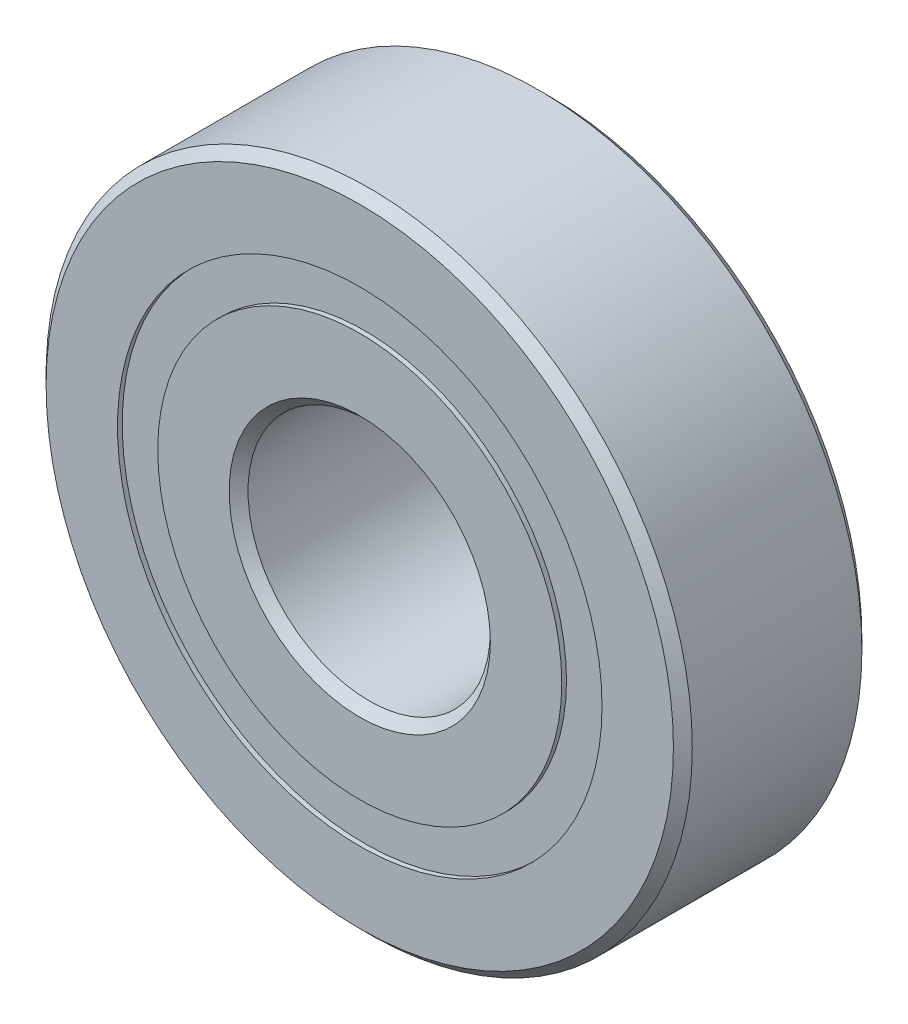
from build123d import *

# Parameters (mm, degrees)
CIRPATTERN1_COUNT = 10
SKETCH5_W         = 1.59927124
SKETCH5_H         = 1.494505494


with BuildPart() as part:
    # Sketch1 → Revolve1 (revolve)
    with BuildSketch(Plane(origin=(0, 0, 0), x_dir=(0, 0, -1), z_dir=(1, 0, 0))):
        with BuildLine():
            Line((3.15, 12), (-3.15, 12))
            Line((-3.15, 12), (-3.5, 11.65))
            Line((-3.5, 11.65), (-3.5, 8.997252747))
            Line((-3.5, 8.997252747), (-1.555555556, 8.997252747))
            ThreePointArc((-1.555555556, 8.997252747), (0, 9.97572876), (1.555555556, 8.997252747))
            Line((1.555555556, 8.997252747), (3.5, 8.997252747))
            Line((3.5, 8.997252747), (3.5, 11.65))
            Line((3.5, 11.65), (3.15, 12))
        make_face()
    revolve(axis=Axis((0, 0, 3.5), (0, 0, -1)))


with BuildPart() as body_2:
    # Sketch3 → Revolve3 (revolve)
    with BuildSketch(Plane(origin=(0, 0, 0), x_dir=(0, 0, -1), z_dir=(1, 0, 0))):
        with BuildLine():
            Line((-3.5, 7.502747253), (-1.555555556, 7.502747253))
            ThreePointArc((-1.555555556, 7.502747253), (0, 6.52427124), (1.555555556, 7.502747253))
            Line((1.555555556, 7.502747253), (3.5, 7.502747253))
            Line((3.5, 7.502747253), (3.5, 4.85))
            Line((3.5, 4.85), (3.15, 4.5))
            Line((3.15, 4.5), (-3.15, 4.5))
            Line((-3.15, 4.5), (-3.5, 4.85))
            Line((-3.5, 4.85), (-3.5, 7.502747253))
        make_face()
    revolve(axis=Axis((0, 0, 3.5), (0, 0, -1)))


with BuildPart() as body_3:
    # Sketch4 → Revolve4 (revolve)
    with BuildSketch(Plane(origin=(0, 0, 0), x_dir=(0, 0, -1), z_dir=(1, 0, 0))):
        with BuildLine():
            Line((-1.72572876, 8.25), (1.72572876, 8.25))
            ThreePointArc((1.72572876, 8.25), (0, 9.97572876), (-1.72572876, 8.25))
        make_face()
    revolve(axis=Axis((0, 8.25, 1.72572876), (0, 0, -1)))


with BuildPart() as cirpattern1_1:
    # CirPattern1: pattern copy
    add(body_3.part.rotate(Axis((0, 0, -3.5), (0, 0, 1)), 1 * 360 / CIRPATTERN1_COUNT))


with BuildPart() as cirpattern1_2:
    # CirPattern1: pattern copy
    add(body_3.part.rotate(Axis((0, 0, -3.5), (0, 0, 1)), 2 * 360 / CIRPATTERN1_COUNT))


with BuildPart() as cirpattern1_3:
    # CirPattern1: pattern copy
    add(body_3.part.rotate(Axis((0, 0, -3.5), (0, 0, 1)), 3 * 360 / CIRPATTERN1_COUNT))


with BuildPart() as cirpattern1_4:
    # CirPattern1: pattern copy
    add(body_3.part.rotate(Axis((0, 0, -3.5), (0, 0, 1)), 4 * 360 / CIRPATTERN1_COUNT))


with BuildPart() as cirpattern1_5:
    # CirPattern1: pattern copy
    add(body_3.part.rotate(Axis((0, 0, -3.5), (0, 0, 1)), 5 * 360 / CIRPATTERN1_COUNT))


with BuildPart() as cirpattern1_6:
    # CirPattern1: pattern copy
    add(body_3.part.rotate(Axis((0, 0, -3.5), (0, 0, 1)), 6 * 360 / CIRPATTERN1_COUNT))


with BuildPart() as cirpattern1_7:
    # CirPattern1: pattern copy
    add(body_3.part.rotate(Axis((0, 0, -3.5), (0, 0, 1)), 7 * 360 / CIRPATTERN1_COUNT))


with BuildPart() as cirpattern1_8:
    # CirPattern1: pattern copy
    add(body_3.part.rotate(Axis((0, 0, -3.5), (0, 0, 1)), 8 * 360 / CIRPATTERN1_COUNT))


with BuildPart() as cirpattern1_9:
    # CirPattern1: pattern copy
    add(body_3.part.rotate(Axis((0, 0, -3.5), (0, 0, 1)), 9 * 360 / CIRPATTERN1_COUNT))


with BuildPart() as body_13:
    # Sketch5 → Revolve5 (revolve)
    with BuildSketch(Plane(origin=(0, 0, 0), x_dir=(0, 0, -1), z_dir=(1, 0, 0))):
        with Locations((-2.52536438, 8.25)):
            Rectangle(SKETCH5_W, SKETCH5_H)
        with Locations((2.52536438, 8.25)):
            Rectangle(SKETCH5_W, SKETCH5_H)
    revolve(axis=Axis((0, 0, 3.5), (0, 0, -1)))


solid = Compound([part.part, body_2.part, body_3.part, cirpattern1_1.part, cirpattern1_2.part, cirpattern1_3.part, cirpattern1_4.part, cirpattern1_5.part, cirpattern1_6.part, cirpattern1_7.part, cirpattern1_8.part, cirpattern1_9.part, body_13.part])
